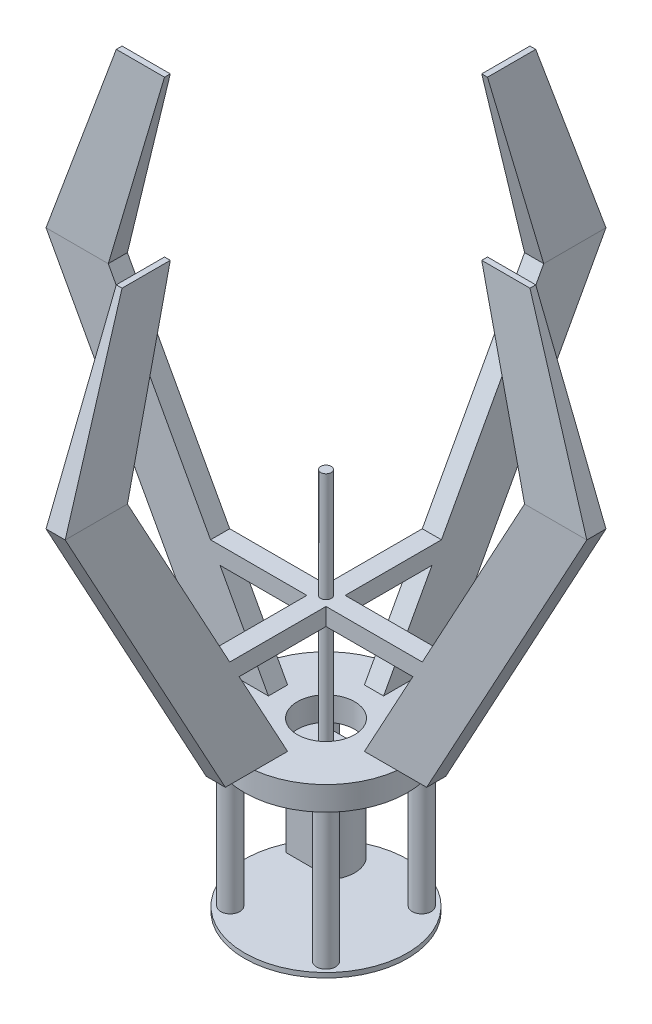
from build123d import *

# Parameters (mm, degrees)
SKETCH1_R            = 17
SKETCH1_R_2          = 2
BOSS_EXTRUDE1_DEPTH  = 1
SKETCH1_3_R          = 2
BOSS_EXTRUDE2_DEPTH  = 30
SKETCH2_R            = 17
SKETCH2_R_2          = 5.981003934
SKETCH2_R_3          = 2
BOSS_EXTRUDE3_DEPTH  = 5
BOSS_EXTRUDE4_DEPTH  = 20
SKETCH3_R            = 1.107736243
BOSS_EXTRUDE5_DEPTH  = 50
SKETCH4_W            = 13
SKETCH4_H            = 4
BOSS_EXTRUDE7_DEPTH  = 70
CIRPATTERN1_COUNT    = 4
CIRPATTERN2_COUNT    = 4
SKETCH9_W            = 4
SKETCH9_H            = 4.134305267
BOSS_EXTRUDE12_DEPTH = 25
CIRPATTERN8_COUNT    = 4


with BuildPart() as part:
    # Sketch1 → Boss-Extrude1 (new body)
    with BuildSketch(Plane(origin=(0, 0, 0), x_dir=(1, 0, 0), z_dir=(0, 1, 0))):
        with Locations(Location((0, 0, 0), (0, 0, 270))):
            Circle(SKETCH1_R)
        with Locations(Location((-10, 10, 0), (0, 0, 270))):
            Circle(SKETCH1_R_2, mode=Mode.SUBTRACT)
        with Locations(Location((10, 10, 0), (0, 0, 270))):
            Circle(SKETCH1_R_2, mode=Mode.SUBTRACT)
        with Locations(Location((10, -10, 0), (0, 0, 270))):
            Circle(SKETCH1_R_2, mode=Mode.SUBTRACT)
        with Locations(Location((-10, -10, 0), (0, 0, 270))):
            Circle(SKETCH1_R_2, mode=Mode.SUBTRACT)
    extrude(amount=BOSS_EXTRUDE1_DEPTH)

    # Sketch1<3> → Boss-Extrude2 (add)
    with BuildSketch(Plane(origin=(0, 0, 0), x_dir=(1, 0, 0), z_dir=(0, 1, 0))):
        with Locations(Location((-10, 10, 0), (0, 0, 270))):
            Circle(SKETCH1_3_R)
        with Locations(Location((10, 10, 0), (0, 0, 270))):
            Circle(SKETCH1_3_R)
        with Locations(Location((10, -10, 0), (0, 0, 270))):
            Circle(SKETCH1_3_R)
        with Locations(Location((-10, -10, 0), (0, 0, 270))):
            Circle(SKETCH1_3_R)
    extrude(amount=BOSS_EXTRUDE2_DEPTH)

    # Sketch2 → Boss-Extrude3 (add)
    # profile 1 of 2: a face of its own
    with BuildSketch(Plane(origin=(0, 30, 0), x_dir=(1, 0, 0), z_dir=(0, 1, 0))):
        with Locations(Location((0, 0, 0), (0, 0, 270))):
            Circle(SKETCH2_R)
        with Locations(Location((0, 0, 0), (0, 0, 270))):
            Circle(SKETCH2_R_2, mode=Mode.SUBTRACT)
        with Locations(Location((-10, 10, 0), (0, 0, 270))):
            Circle(SKETCH2_R_3, mode=Mode.SUBTRACT)
    # profile 2 of 2: a face of its own
    with BuildSketch(Plane(origin=(0, 30, 0), x_dir=(1, 0, 0), z_dir=(0, 1, 0))):
        with Locations(Location((-10, 10, 0), (0, 0, 270))):
            Circle(SKETCH2_R_3)
    extrude(amount=BOSS_EXTRUDE3_DEPTH)

    # Sketch4 → Boss-Extrude7 (add, along a direction that is not the sketch's normal)
    with BuildSketch(Plane(origin=(0, 35, 0), x_dir=(1, 0, 0), z_dir=(0, 1, 0))):
        with Locations((-16.527954488, 0)):
            Rectangle(SKETCH4_W, SKETCH4_H)
    boss_extrude7 = extrude(amount=BOSS_EXTRUDE7_DEPTH, dir=(-0.47798722714939545, 0.8783667859624659, 0))

    # Boss-Extrude8: read off the stored shape, not the designer's step
    # Boss-Extrude8: loft between two sections, ruled curve by curve
    boss_extrude8_from = [
        Edge.make_line((-56.487060388, 96.485675017, -2), (-56.487060388, 96.485675017, 2)),
        Edge.make_line((-56.487060388, 96.485675017, 2), (-43.487060388, 96.485675017, 2)),
        Edge.make_line((-43.487060388, 96.485675017, 2), (-43.487060388, 96.485675017, -2)),
        Edge.make_line((-43.487060388, 96.485675017, -2), (-56.487060388, 96.485675017, -2)),
    ]
    boss_extrude8_to = [
        Edge.make_line((-43.209188151, 134.705549787, -0.603088029), (-43.209188151, 134.705549787, 0.603088029)),
        Edge.make_line((-43.209188151, 134.705549787, 0.603088029), (-33.133306924, 134.705549787, 0.603088029)),
        Edge.make_line((-33.133306924, 134.705549787, 0.603088029), (-33.133306924, 134.705549787, -0.603088029)),
        Edge.make_line((-33.133306924, 134.705549787, -0.603088029), (-43.209188151, 134.705549787, -0.603088029)),
    ]
    boss_extrude8 = Solid(Shell([*[Face.make_surface_from_curves(boss_extrude8_from[k], boss_extrude8_to[k]) for k in range(4)], Face(Wire(boss_extrude8_from)), Face(Wire(boss_extrude8_to))]))
    add(boss_extrude8)

    # CirPattern1: Boss-Extrude7 ×4 about axis
    cirpattern1_axis = Axis((0, 0, 0), (0, 1, 0))
    for i in range(1, CIRPATTERN1_COUNT):
        add(boss_extrude7.rotate(cirpattern1_axis, i * 360 / CIRPATTERN1_COUNT))

    # CirPattern2: Boss-Extrude8 ×4 about axis
    cirpattern2_axis = Axis((0, 0, 0), (0, 1, 0))
    for i in range(1, CIRPATTERN2_COUNT):
        add(boss_extrude8.rotate(cirpattern2_axis, i * 360 / CIRPATTERN2_COUNT))

    # Sketch9 → Boss-Extrude12 (add, along a direction that is not the sketch's normal)
    with BuildSketch(Plane(origin=(6.957833873, 3.786294943, 0), x_dir=(0, 0, -1), z_dir=(0.8783667859624659, 0.47798722714939545, 0))):
        with Locations((0, 58.75999588)):
            Rectangle(SKETCH9_W, SKETCH9_H)
    boss_extrude12 = extrude(amount=BOSS_EXTRUDE12_DEPTH, dir=(1, 0, 0))

    # CirPattern8: Boss-Extrude12 ×4 about axis
    cirpattern8_axis = Axis((0, 80, 0), (0, 1, 0))
    for i in range(1, CIRPATTERN8_COUNT):
        add(boss_extrude12.rotate(cirpattern8_axis, i * 360 / CIRPATTERN8_COUNT))


with BuildPart() as body_2:
    # Sketch2<3> → Boss-Extrude4 (new body)
    with BuildSketch(Plane(origin=(0, 30, 0), x_dir=(1, 0, 0), z_dir=(0, 1, 0))):
        with BuildLine():
            Line((4.853270007, 3.495451086), (-4.853270007, 3.495451086))
            ThreePointArc((-4.853270007, 3.495451086), (-5.981003934, 0), (-4.853270007, -3.495451086))
            Line((-4.853270007, -3.495451086), (4.853270007, -3.495451086))
            ThreePointArc((4.853270007, -3.495451086), (5.692092544, -1.836434188), (5.981003934, 0))
            ThreePointArc((5.981003934, 0), (5.692092544, 1.836434188), (4.853270007, 3.495451086))
        make_face()
    extrude(amount=-BOSS_EXTRUDE4_DEPTH)

    # Sketch3 → Boss-Extrude5 (add)
    with BuildSketch(Plane(origin=(0, 30, 0), x_dir=(1, 0, 0), z_dir=(0, 1, 0))):
        with Locations(Location((0, 0, 0), (0, 0, 270))):
            Circle(SKETCH3_R)
    extrude(amount=BOSS_EXTRUDE5_DEPTH)


solid = Compound([part.part, body_2.part])
